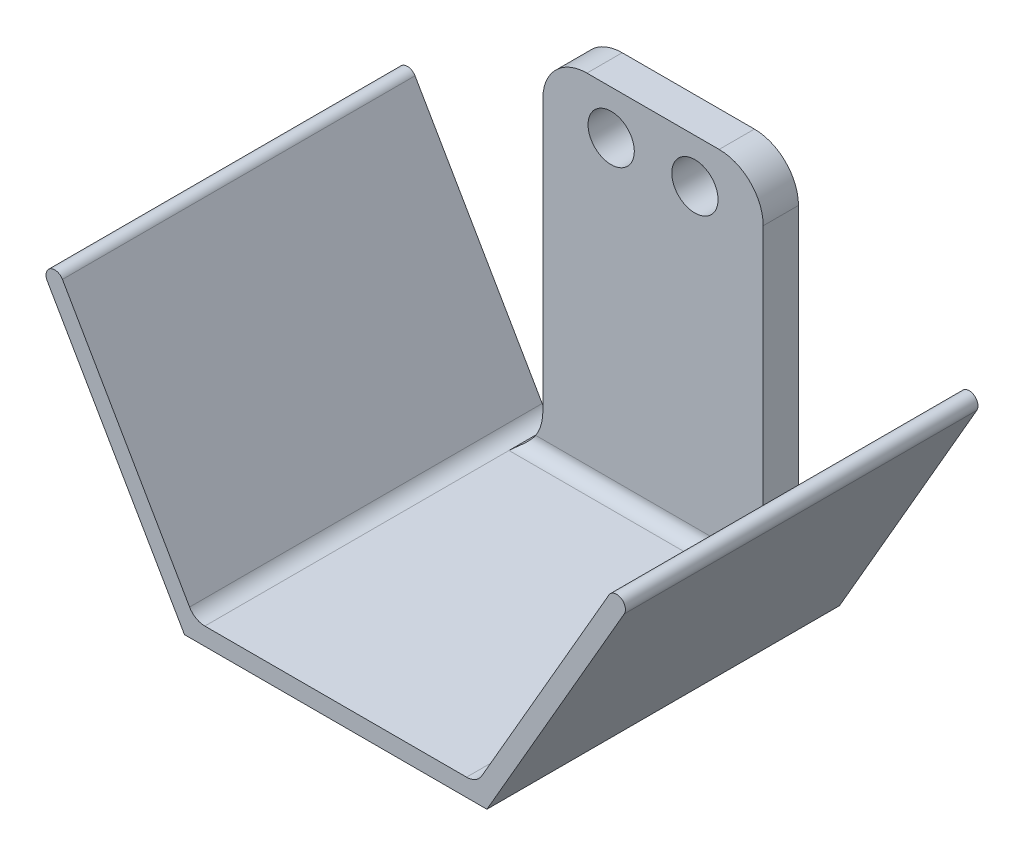
from build123d import *

# Parameters (mm, degrees)
BOSS_EXTRUDE2_DEPTH = 40
FILLET1_R           = 4
SKETCH3_W           = 50
SKETCH3_H           = 8
BOSS_EXTRUDE3_DEPTH = 80
SKETCH5_R           = 5.25
CUT_EXTRUDE1_DEPTH  = 127.113847389
FILLET2_R           = 10
FILLET3_R           = 3


with BuildPart() as part:
    # Sketch2 → Boss-Extrude2 (new, symmetric)
    with BuildSketch(Plane.XY):
        with BuildLine():
            Line((-32, 0), (32, 0))
            Line((32, 0), (62, 51.961524227))
            ThreePointArc((62, 51.961524227), (64.732050808, 52.693575035), (65.464101615, 49.961524227))
            Line((65.464101615, 49.961524227), (34.309401077, -4))
            Line((34.309401077, -4), (-34.309401077, -4))
            Line((-34.309401077, -4), (-65.464101615, 49.961524227))
            ThreePointArc((-65.464101615, 49.961524227), (-64.732050808, 52.693575035), (-62, 51.961524227))
            Line((-62, 51.961524227), (-32, 0))
        make_face()
    extrude(amount=BOSS_EXTRUDE2_DEPTH, both=True)

    # Fillet1
    fillet1_edges = [part.edges().sort_by_distance(p)[0] for p in [
        (-32, 0, 0),
        (32, 0, 0),
    ]]
    fillet(fillet1_edges, radius=FILLET1_R)

    # Sketch3 → Boss-Extrude3 (add)
    with BuildSketch(Plane(origin=(0, 0, 0), x_dir=(1, 0, 0), z_dir=(0, 1, 0))):
        with Locations((0, 36)):
            Rectangle(SKETCH3_W, SKETCH3_H)
    extrude(amount=BOSS_EXTRUDE3_DEPTH)

    # Sketch5 → Cut-Extrude1 (cut, through all)
    with BuildSketch(Plane.XY.offset(-32)):
        with Locations((-9.5, 70)):
            Circle(SKETCH5_R)
        with Locations((9.5, 70)):
            Circle(SKETCH5_R)
    extrude(amount=-CUT_EXTRUDE1_DEPTH, mode=Mode.SUBTRACT)

    # Fillet2
    # the kernel refuses this fillet: 10 mm, written as the material it adds along each edge
    with BuildSketch(Plane(origin=(25, 0, -40), x_dir=(1, 0, 0), z_dir=(0, 0, 1)), Plane(origin=(-25, 0, -32), x_dir=(-1, 0, 0), z_dir=(0, 0, -1))) as fillet2_piece_1:
        with BuildLine():
            CenterArc((10, 8.474093474), FILLET2_R, 180, 57.931003855)
            Line((0, 8.474093474), (0, 0))
            Line((0, 0), (4.690598923, 0))
        make_face()
    extrude(amount=8)
    # the kernel refuses this fillet: 10 mm, written as the material it takes off along each edge
    with BuildSketch(Plane(origin=(25, 80, -65), x_dir=(0, -1, 0), z_dir=(0, 0, 1))) as fillet2_2_piece_1:
        with BuildLine():
            CenterArc((FILLET2_R, -FILLET2_R), FILLET2_R, 90, 90)
            Line((0, -FILLET2_R), (0, 0))
            Line((0, 0), (FILLET2_R, 0))
        make_face()
    extrude(amount=58, mode=Mode.SUBTRACT)
    with BuildSketch(Plane(origin=(-25, 80, -7), x_dir=(1, 0, 0), z_dir=(0, 0, -1))) as fillet2_2_piece_2:
        with BuildLine():
            CenterArc((FILLET2_R, FILLET2_R), FILLET2_R, 180, 90)
            Line((0, FILLET2_R), (0, 0))
            Line((0, 0), (FILLET2_R, 0))
        make_face()
    extrude(amount=58, mode=Mode.SUBTRACT)

    # Fillet3
    # the kernel refuses this fillet: 3 mm, written as the material it adds along each edge
    with BuildSketch(Plane(origin=(-37.190598923, 0, -32), x_dir=(0, 1, 0), z_dir=(1, 0, 0))) as fillet3_piece_1_section:
        with BuildLine():
            CenterArc((FILLET3_R, FILLET3_R), FILLET3_R, 180, 90)
            Line((0, FILLET3_R), (0, 0))
            Line((0, 0), (FILLET3_R, 0))
        make_face()
    fillet3_piece_1 = extrude(amount=74.381197846, mode=Mode.PRIVATE)
    fillet3_piece_1 = fillet3_piece_1 - Plane(origin=(35, 8.474093474, -32), x_dir=(1, 0, 0), z_dir=(0, 0, -1)) * Cylinder(10, 161, mode=Mode.PRIVATE)
    fillet3_piece_1 = fillet3_piece_1 - Plane(origin=(-35, 8.474093474, -32), x_dir=(-1, 0, 0), z_dir=(0, 0, 1)) * Cylinder(10, 161, mode=Mode.PRIVATE)
    add(fillet3_piece_1)


solid = part.part
